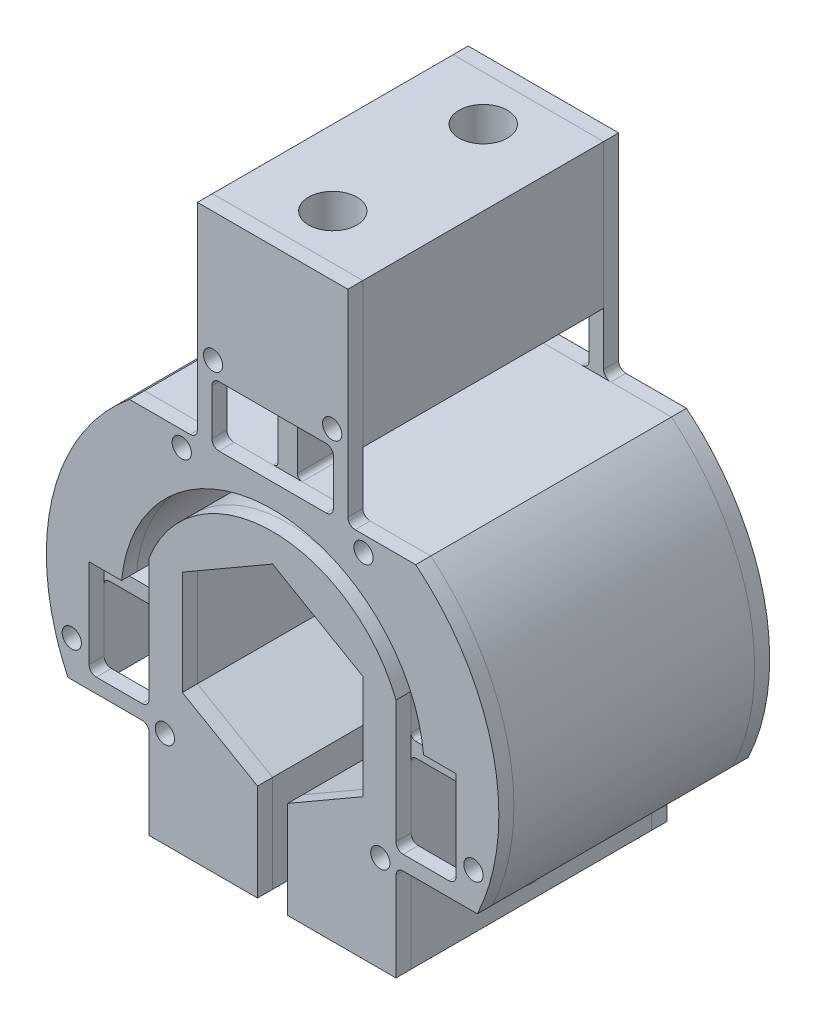
from build123d import *

# Parameters (mm, degrees)
MONKEY_CENTER_W                      = 15.875
MONKEY_CENTER_H                      = 15.24
MONKEY_CENTER_W_2                    = 2.032
MONKEY_CENTER_H_2                    = 6.35
MONKEY_CENTER_W_3                    = 6.35
MONKEY_CENTER_H_3                    = 1.524
CENTRAL_MONKEY_DEPTH                 = 12.7
CENTRAL_MONKEY_FILLETS_R             = 0.508
MONKEY_FRONT_W                       = 15.875
MONKEY_FRONT_H                       = 15.24
MONKEY_FRONT_W_2                     = 1.524
MONKEY_FRONT_H_2                     = 6.35
MONKEY_FRONT_W_3                     = 6.35
MONKEY_FRONT_H_3                     = 1.524
FRONT_MONKEY_DEPTH                   = 1.5875
FRONT_MONKEY_FILLETS_R               = 0.762
TAP_DRILL_FOR_2_56_TAP1_AT_2_COUNT   = 2
TAP_DRILL_FOR_2_56_TAP1_AT_2_PITCH   = 12.573
TAP_DRILL_FOR_2_56_TAP1_AT_3_COUNT   = 2
TAP_DRILL_FOR_2_56_TAP1_AT_3_PITCH   = 18.578932397
TAP_DRILL_FOR_2_56_TAP1_AT_4_COUNT   = 2
TAP_DRILL_FOR_2_56_TAP1_AT_4_PITCH   = 10.201191499
TAP_DRILL_FOR_2_56_TAP1_AT_5_COUNT   = 2
TAP_DRILL_FOR_2_56_TAP1_AT_5_PITCH   = 36.068614046
TAP_DRILL_FOR_2_56_TAP1_AT_6_COUNT   = 2
TAP_DRILL_FOR_2_56_TAP1_AT_6_PITCH   = 37.005085657
TAP_DRILL_FOR_2_56_TAP1_AT_7_COUNT   = 2
TAP_DRILL_FOR_2_56_TAP1_AT_7_PITCH   = 40.684129258
TAP_DRILL_FOR_2_56_TAP1_AT_8_COUNT   = 2
TAP_DRILL_FOR_2_56_TAP1_AT_8_PITCH   = 42.8232872
BOLT_CLEARANCE_R                     = 1.016
CLEARANCE_DEPTH                      = 26.9875
BOLTS_MIRROR_START                   = -14.2875
BOLTS_MIRROR_OUTLINE_R               = 1.016
BOLTS_MIRROR_DEPTH                   = 1.5875
SKETCH16_W                           = 1.35255
SKETCH16_H                           = 11.431
TAP_DRILL_FOR_1_4_20_TAP1_AT_2_COUNT = 2
TAP_DRILL_FOR_1_4_20_TAP1_AT_2_PITCH = 15.875


# Read off the part's stored shape, not the designer's step: bolts-mirror
with BuildPart() as part:
    # monkey-center → central-monkey (new, symmetric)
    with BuildSketch(Plane.XY):
        with Locations((0, 32.46374)):
            Rectangle(MONKEY_CENTER_W, MONKEY_CENTER_H)
        with Locations((0, 21.66874)):
            Rectangle(MONKEY_CENTER_W_2, MONKEY_CENTER_H_2)
        with BuildLine():
            Line((21.606429043, -10.16), (19.3675, -10.16))
            Line((19.3675, -10.16), (19.3675, 1.524))
            Line((19.3675, 1.524), (15.932887217, 1.524))
            ThreePointArc((15.932887217, 1.524), (0, 16.005607489), (-15.932887217, 1.524))
            Line((-15.932887217, 1.524), (-19.3675, 1.524))
            Line((-19.3675, 1.524), (-19.3675, -10.16))
            Line((-19.3675, -10.16), (-21.606429043, -10.16))
            ThreePointArc((-21.606429043, -10.16), (-23.283490521, 5.286061404), (-15.101157466, 18.49374))
            Line((-15.101157466, 18.49374), (15.101157466, 18.49374))
            ThreePointArc((15.101157466, 18.49374), (23.283490521, 5.286061404), (21.606429043, -10.16))
        make_face()
        with BuildLine():
            Line((-1.5875, -10.081979076), (-9.525, -5.499261314))
            Line((-9.525, -5.499261314), (-9.525, 5.499261314))
            Line((-9.525, 5.499261314), (0, 10.998522628))
            Line((0, 10.998522628), (9.525, 5.499261314))
            Line((9.525, 5.499261314), (9.525, -5.499261314))
            Line((9.525, -5.499261314), (1.5875, -10.081979076))
            Line((1.5875, -10.081979076), (1.5875, -20.32))
            Line((1.5875, -20.32), (13.0175, -20.32))
            Line((13.0175, -20.32), (13.0175, -0.762))
            Line((13.0175, -0.762), (13.0175, 0.762))
            Line((13.0175, 0.762), (13.0175, 5.08))
            ThreePointArc((13.0175, 5.08), (0, 13.973607489), (-13.0175, 5.08))
            Line((-13.0175, 5.08), (-13.0175, 0.762))
            Line((-13.0175, 0.762), (-13.0175, -0.762))
            Line((-13.0175, -0.762), (-13.0175, -20.32))
            Line((-13.0175, -20.32), (-1.5875, -20.32))
            Line((-1.5875, -20.32), (-1.5875, -10.081979076))
        make_face()
        with Locations((-16.1925, 0)):
            Rectangle(MONKEY_CENTER_W_3, MONKEY_CENTER_H_3)
        with Locations((16.1925, 0)):
            Rectangle(MONKEY_CENTER_W_3, MONKEY_CENTER_H_3)
    extrude(amount=CENTRAL_MONKEY_DEPTH, both=True)

    # central-monkey-fillets
    central_monkey_fillets_edges = [part.edges().sort_by_distance(p)[0] for p in [
        (13.0175, 0.762, 0),
        (19.3675, 0.762, 0),
        (-19.3675, 0.762, 0),
        (-13.0175, 0.762, 0),
        (-19.3675, -0.762, 0),
        (-1.016, 18.49374, 0),
        (-1.016, 24.84374, 0),
        (1.016, 24.84374, 0),
        (1.016, 18.49374, 0),
        (19.3675, -0.762, 0),
        (13.0175, -0.762, 0),
        (-13.0175, -0.762, 0),
    ]]
    fillet(central_monkey_fillets_edges, radius=CENTRAL_MONKEY_FILLETS_R)


with BuildPart() as body_2:
    # monkey-front → front-monkey (new body)
    with BuildSketch(Plane.XY.offset(12.7)):
        with Locations((0, 32.46374)):
            Rectangle(MONKEY_FRONT_W, MONKEY_FRONT_H)
        with Locations((-7.1755, 21.66874)):
            Rectangle(MONKEY_FRONT_W_2, MONKEY_FRONT_H_2)
        with Locations((7.1755, 21.66874)):
            Rectangle(MONKEY_FRONT_W_2, MONKEY_FRONT_H_2)
        with BuildLine():
            Line((21.606429043, -10.16), (19.3675, -10.16))
            Line((19.3675, -10.16), (19.3675, 1.524))
            Line((19.3675, 1.524), (15.932887217, 1.524))
            ThreePointArc((15.932887217, 1.524), (0, 16.005607489), (-15.932887217, 1.524))
            Line((-15.932887217, 1.524), (-19.3675, 1.524))
            Line((-19.3675, 1.524), (-19.3675, -10.16))
            Line((-19.3675, -10.16), (-21.606429043, -10.16))
            ThreePointArc((-21.606429043, -10.16), (-23.283490521, 5.286061404), (-15.101157466, 18.49374))
            Line((-15.101157466, 18.49374), (15.101157466, 18.49374))
            ThreePointArc((15.101157466, 18.49374), (23.283490521, 5.286061404), (21.606429043, -10.16))
        make_face()
        with BuildLine():
            Line((-1.5875, -10.081979076), (-9.525, -5.499261314))
            Line((-9.525, -5.499261314), (-9.525, 5.499261314))
            Line((-9.525, 5.499261314), (0, 10.998522628))
            Line((0, 10.998522628), (9.525, 5.499261314))
            Line((9.525, 5.499261314), (9.525, -5.499261314))
            Line((9.525, -5.499261314), (1.5875, -10.081979076))
            Line((1.5875, -10.081979076), (1.5875, -20.32))
            Line((1.5875, -20.32), (13.0175, -20.32))
            Line((13.0175, -20.32), (13.0175, -10.16))
            Line((13.0175, -10.16), (13.0175, -8.636))
            Line((13.0175, -8.636), (13.0175, 5.08))
            ThreePointArc((13.0175, 5.08), (0, 13.973607489), (-13.0175, 5.08))
            Line((-13.0175, 5.08), (-13.0175, -8.636))
            Line((-13.0175, -8.636), (-13.0175, -10.16))
            Line((-13.0175, -10.16), (-13.0175, -20.32))
            Line((-13.0175, -20.32), (-1.5875, -20.32))
            Line((-1.5875, -20.32), (-1.5875, -10.081979076))
        make_face()
        with Locations((-16.1925, -9.398)):
            Rectangle(MONKEY_FRONT_W_3, MONKEY_FRONT_H_3)
        with Locations((16.1925, -9.398)):
            Rectangle(MONKEY_FRONT_W_3, MONKEY_FRONT_H_3)
    extrude(amount=FRONT_MONKEY_DEPTH)

    # front-monkey-fillets
    front_monkey_fillets_edges = [body_2.edges().sort_by_distance(p)[0] for p in [
        (6.4135, 18.49374, 13.49375),
        (6.4135, 24.84374, 13.49375),
        (-6.4135, 24.84374, 13.49375),
        (-6.4135, 18.49374, 13.49375),
        (13.0175, -8.636, 13.49375),
        (19.3675, -8.636, 13.49375),
        (-19.3675, -8.636, 13.49375),
        (-13.0175, -8.636, 13.49375),
        (-7.9375, 18.49374, 13.49375),
        (7.9375, 18.49374, 13.49375),
        (13.0175, -10.16, 13.49375),
        (-13.0175, -10.16, 13.49375),
    ]]
    fillet(front_monkey_fillets_edges, radius=FRONT_MONKEY_FILLETS_R)


with BuildPart() as body_3:
    # back-monkey: mirrored copy
    add(body_2.part.mirror(Plane.XY))

    # bolts-mirror outline → bolts-mirror (cut)
    with BuildSketch(Plane.XY.offset(BOLTS_MIRROR_START)):
        with Locations((-21.191800182, -6.35)):
            Circle(BOLTS_MIRROR_OUTLINE_R)
        with Locations((-6.2865, 26.49474)):
            Circle(BOLTS_MIRROR_OUTLINE_R)
        with Locations((21.191800182, -6.35)):
            Circle(BOLTS_MIRROR_OUTLINE_R)
        with Locations((11.3665, -10.16)):
            Circle(BOLTS_MIRROR_OUTLINE_R)
        with Locations((-11.3665, -10.16)):
            Circle(BOLTS_MIRROR_OUTLINE_R)
        with Locations((6.2865, 26.49474)):
            Circle(BOLTS_MIRROR_OUTLINE_R)
        with Locations((-9.5885, 16.84274)):
            Circle(BOLTS_MIRROR_OUTLINE_R)
        with Locations((9.5885, 16.84274)):
            Circle(BOLTS_MIRROR_OUTLINE_R)
    extrude(amount=BOLTS_MIRROR_DEPTH, mode=Mode.SUBTRACT)


with BuildPart() as tap_drill_for_2_56_tap1_tool:
    # Sketch9 → Tap Drill for #2-56 Tap1 (revolve)
    with BuildSketch(Plane(origin=(-6.2865, 26.49474, 14.2875), x_dir=(0, -1, 0), z_dir=(1, 0, 0))):
        Polygon((0, 0), (0, 6.88416509), (0.889, 6.35), (0.889, 0), align=None)
    tap_drill_for_2_56_tap1 = revolve(axis=Axis((-6.2865, 26.49474, 20.6375), (0, 0, -1)))


with BuildPart() as part_1:
    add(part.part)

    # Tap Drill for #2-56 Tap1: cut by tap_drill_for_2_56_tap1_tool
    add(tap_drill_for_2_56_tap1_tool.part, mode=Mode.SUBTRACT)


with BuildPart() as body_2_1:
    add(body_2.part)

    # Tap Drill for #2-56 Tap1: cut by tap_drill_for_2_56_tap1_tool
    add(tap_drill_for_2_56_tap1_tool.part, mode=Mode.SUBTRACT)


with BuildPart() as tap_drill_for_2_56_tap1_at_2_tool:
    # Tap Drill for #2-56 Tap1 at 2: Tap Drill for #2-56 Tap1 ×2
    with Locations(*[(i * TAP_DRILL_FOR_2_56_TAP1_AT_2_PITCH, 0, 0) for i in range(1, TAP_DRILL_FOR_2_56_TAP1_AT_2_COUNT)]):
        add(tap_drill_for_2_56_tap1)


with BuildPart() as part_2:
    add(part_1.part)

    # Tap Drill for #2-56 Tap1 at 2: cut by tap_drill_for_2_56_tap1_at_2_tool
    add(tap_drill_for_2_56_tap1_at_2_tool.part, mode=Mode.SUBTRACT)


with BuildPart() as body_2_2:
    add(body_2_1.part)

    # Tap Drill for #2-56 Tap1 at 2: cut by tap_drill_for_2_56_tap1_at_2_tool
    add(tap_drill_for_2_56_tap1_at_2_tool.part, mode=Mode.SUBTRACT)


with BuildPart() as tap_drill_for_2_56_tap1_at_3_tool:
    # Tap Drill for #2-56 Tap1 at 3: Tap Drill for #2-56 Tap1 ×2
    with Locations(*[Vector(0.8544624449382326, -0.5195131665224453, 0) * (i * TAP_DRILL_FOR_2_56_TAP1_AT_3_PITCH) for i in range(1, TAP_DRILL_FOR_2_56_TAP1_AT_3_COUNT)]):
        add(tap_drill_for_2_56_tap1)


with BuildPart() as part_3:
    add(part_2.part)

    # Tap Drill for #2-56 Tap1 at 3: cut by tap_drill_for_2_56_tap1_at_3_tool
    add(tap_drill_for_2_56_tap1_at_3_tool.part, mode=Mode.SUBTRACT)


with BuildPart() as body_2_3:
    add(body_2_2.part)

    # Tap Drill for #2-56 Tap1 at 3: cut by tap_drill_for_2_56_tap1_at_3_tool
    add(tap_drill_for_2_56_tap1_at_3_tool.part, mode=Mode.SUBTRACT)


with BuildPart() as tap_drill_for_2_56_tap1_at_4_tool:
    # Tap Drill for #2-56 Tap1 at 4: Tap Drill for #2-56 Tap1 ×2
    with Locations(*[Vector(-0.32368767906299, -0.9461639849533562, 0) * (i * TAP_DRILL_FOR_2_56_TAP1_AT_4_PITCH) for i in range(1, TAP_DRILL_FOR_2_56_TAP1_AT_4_COUNT)]):
        add(tap_drill_for_2_56_tap1)


with BuildPart() as part_4:
    add(part_3.part)

    # Tap Drill for #2-56 Tap1 at 4: cut by tap_drill_for_2_56_tap1_at_4_tool
    add(tap_drill_for_2_56_tap1_at_4_tool.part, mode=Mode.SUBTRACT)


with BuildPart() as body_2_4:
    add(body_2_3.part)

    # Tap Drill for #2-56 Tap1 at 4: cut by tap_drill_for_2_56_tap1_at_4_tool
    add(tap_drill_for_2_56_tap1_at_4_tool.part, mode=Mode.SUBTRACT)


with BuildPart() as tap_drill_for_2_56_tap1_at_5_tool:
    # Tap Drill for #2-56 Tap1 at 5: Tap Drill for #2-56 Tap1 ×2
    with Locations(*[Vector(-0.41324848699182054, -0.9106182998375176, 0) * (i * TAP_DRILL_FOR_2_56_TAP1_AT_5_PITCH) for i in range(1, TAP_DRILL_FOR_2_56_TAP1_AT_5_COUNT)]):
        add(tap_drill_for_2_56_tap1)


with BuildPart() as part_5:
    add(part_4.part)

    # Tap Drill for #2-56 Tap1 at 5: cut by tap_drill_for_2_56_tap1_at_5_tool
    add(tap_drill_for_2_56_tap1_at_5_tool.part, mode=Mode.SUBTRACT)


with BuildPart() as body_2_5:
    add(body_2_4.part)

    # Tap Drill for #2-56 Tap1 at 5: cut by tap_drill_for_2_56_tap1_at_5_tool
    add(tap_drill_for_2_56_tap1_at_5_tool.part, mode=Mode.SUBTRACT)


with BuildPart() as tap_drill_for_2_56_tap1_at_6_tool:
    # Tap Drill for #2-56 Tap1 at 6: Tap Drill for #2-56 Tap1 ×2
    with Locations(*[Vector(-0.1372784283520656, -0.9905324997743319, 0) * (i * TAP_DRILL_FOR_2_56_TAP1_AT_6_PITCH) for i in range(1, TAP_DRILL_FOR_2_56_TAP1_AT_6_COUNT)]):
        add(tap_drill_for_2_56_tap1)


with BuildPart() as part_6:
    add(part_5.part)

    # Tap Drill for #2-56 Tap1 at 6: cut by tap_drill_for_2_56_tap1_at_6_tool
    add(tap_drill_for_2_56_tap1_at_6_tool.part, mode=Mode.SUBTRACT)


with BuildPart() as body_2_6:
    add(body_2_5.part)

    # Tap Drill for #2-56 Tap1 at 6: cut by tap_drill_for_2_56_tap1_at_6_tool
    add(tap_drill_for_2_56_tap1_at_6_tool.part, mode=Mode.SUBTRACT)


with BuildPart() as tap_drill_for_2_56_tap1_at_7_tool:
    # Tap Drill for #2-56 Tap1 at 7: Tap Drill for #2-56 Tap1 ×2
    with Locations(*[Vector(0.4339038421623268, -0.9009591865100054, 0) * (i * TAP_DRILL_FOR_2_56_TAP1_AT_7_PITCH) for i in range(1, TAP_DRILL_FOR_2_56_TAP1_AT_7_COUNT)]):
        add(tap_drill_for_2_56_tap1)


with BuildPart() as part_7:
    add(part_6.part)

    # Tap Drill for #2-56 Tap1 at 7: cut by tap_drill_for_2_56_tap1_at_7_tool
    add(tap_drill_for_2_56_tap1_at_7_tool.part, mode=Mode.SUBTRACT)


with BuildPart() as body_2_7:
    add(body_2_6.part)

    # Tap Drill for #2-56 Tap1 at 7: cut by tap_drill_for_2_56_tap1_at_7_tool
    add(tap_drill_for_2_56_tap1_at_7_tool.part, mode=Mode.SUBTRACT)


with BuildPart() as tap_drill_for_2_56_tap1_at_8_tool:
    # Tap Drill for #2-56 Tap1 at 8: Tap Drill for #2-56 Tap1 ×2
    with Locations(*[Vector(0.64166723246373, -0.7669831567787767, 0) * (i * TAP_DRILL_FOR_2_56_TAP1_AT_8_PITCH) for i in range(1, TAP_DRILL_FOR_2_56_TAP1_AT_8_COUNT)]):
        add(tap_drill_for_2_56_tap1)


with BuildPart() as part_8:
    add(part_7.part)

    # Tap Drill for #2-56 Tap1 at 8: cut by tap_drill_for_2_56_tap1_at_8_tool
    add(tap_drill_for_2_56_tap1_at_8_tool.part, mode=Mode.SUBTRACT)

    # bolts-mirror 2 outline → bolts-mirror 2 (revolve, cut)
    with BuildSketch(Plane(origin=(21.191800182, -6.35, 0), x_dir=(1, 0, 0), z_dir=(0, -1, 0))):
        Polygon((0.889, -12.7), (0.889, -7.9375), (0, -7.40333491), (0, -12.7), align=None)
    revolve(axis=Axis((21.191800182, -6.35, 0), (0, 0, 1)), mode=Mode.SUBTRACT)

    # bolts-mirror 3 outline → bolts-mirror 3 (revolve, cut)
    with BuildSketch(Plane(origin=(11.3665, -10.16, 0), x_dir=(1, 0, 0), z_dir=(0, -1, 0))):
        Polygon((0.889, -12.7), (0.889, -7.9375), (0, -7.40333491), (0, -12.7), align=None)
    revolve(axis=Axis((11.3665, -10.16, 0), (0, 0, 1)), mode=Mode.SUBTRACT)

    # bolts-mirror 4 outline → bolts-mirror 4 (revolve, cut)
    with BuildSketch(Plane(origin=(-11.3665, -10.16, 0), x_dir=(1, 0, 0), z_dir=(0, -1, 0))):
        Polygon((0.889, -12.7), (0.889, -7.9375), (0, -7.40333491), (0, -12.7), align=None)
    revolve(axis=Axis((-11.3665, -10.16, 0), (0, 0, 1)), mode=Mode.SUBTRACT)

    # bolts-mirror 5 outline → bolts-mirror 5 (revolve, cut)
    with BuildSketch(Plane(origin=(-21.191800182, -6.35, 0), x_dir=(1, 0, 0), z_dir=(0, -1, 0))):
        Polygon((0.889, -12.7), (0.889, -7.9375), (0, -7.40333491), (0, -12.7), align=None)
    revolve(axis=Axis((-21.191800182, -6.35, 0), (0, 0, 1)), mode=Mode.SUBTRACT)

    # bolts-mirror 6 outline → bolts-mirror 6 (revolve, cut)
    with BuildSketch(Plane(origin=(-9.5885, 16.84274, 0), x_dir=(1, 0, 0), z_dir=(0, -1, 0))):
        Polygon((0.889, -12.7), (0.889, -7.9375), (0, -7.40333491), (0, -12.7), align=None)
    revolve(axis=Axis((-9.5885, 16.84274, 0), (0, 0, 1)), mode=Mode.SUBTRACT)

    # bolts-mirror 7 outline → bolts-mirror 7 (revolve, cut)
    with BuildSketch(Plane(origin=(9.5885, 16.84274, 0), x_dir=(1, 0, 0), z_dir=(0, -1, 0))):
        Polygon((0.889, -12.7), (0.889, -7.9375), (0, -7.40333491), (0, -12.7), align=None)
    revolve(axis=Axis((9.5885, 16.84274, 0), (0, 0, 1)), mode=Mode.SUBTRACT)

    # bolts-mirror 8 outline → bolts-mirror 8 (revolve, cut)
    with BuildSketch(Plane(origin=(6.2865, 26.49474, 0), x_dir=(1, 0, 0), z_dir=(0, -1, 0))):
        Polygon((0.889, -12.7), (0.889, -7.9375), (0, -7.40333491), (0, -12.7), align=None)
    revolve(axis=Axis((6.2865, 26.49474, 0), (0, 0, 1)), mode=Mode.SUBTRACT)

    # bolts-mirror 9 outline → bolts-mirror 9 (revolve, cut)
    with BuildSketch(Plane(origin=(-6.2865, 26.49474, 0), x_dir=(1, 0, 0), z_dir=(0, -1, 0))):
        Polygon((0.889, -12.7), (0.889, -7.9375), (0, -7.40333491), (0, -12.7), align=None)
    revolve(axis=Axis((-6.2865, 26.49474, 0), (0, 0, 1)), mode=Mode.SUBTRACT)

    # Sketch13 → CBORE for #6 Socket Head Cap Screw1 (revolve, cut)
    with BuildSketch(Plane(origin=(13.0175, -15.24, 0), x_dir=(0, 0, -1), z_dir=(0, 1, 0))):
        Polygon((0, 0), (0, 11.43), (1.89865, 11.43), (1.89865, 3.5052), (3.57251, 3.5052), (3.57251, 0), align=None)
    revolve(axis=Axis((19.3675, -15.24, 0), (-1, 0, 0)), mode=Mode.SUBTRACT)

    # Sketch16 → Tap Drill for #6-32 Tap1 (revolve, cut)
    with BuildSketch(Plane(origin=(-13.0175, -15.24, 0), x_dir=(0, 0, 1), z_dir=(0, 1, 0))):
        with Locations((0.676275, 5.7155)):
            Rectangle(SKETCH16_W, SKETCH16_H)
    revolve(axis=Axis((-19.3675, -15.24, 0), (1, 0, 0)), mode=Mode.SUBTRACT)

    # Sketch19 → Tap Drill for 1/4-20 Tap1 (revolve, cut)
    with BuildSketch(Plane(origin=(0, 40.08374, 7.9375), x_dir=(0, 0, 1), z_dir=(1, 0, 0))):
        Polygon((0, 0), (0, 11.693816902), (2.5527, 10.16), (2.5527, 0), align=None)
    tap_drill_for_1_4_20_tap1 = revolve(axis=Axis((0, 46.43374, 7.9375), (0, -1, 0)), mode=Mode.SUBTRACT)

    # Tap Drill for 1/4-20 Tap1 at 2: Tap Drill for 1/4-20 Tap1 ×2
    with Locations(*[(0, 0, -i * TAP_DRILL_FOR_1_4_20_TAP1_AT_2_PITCH) for i in range(1, TAP_DRILL_FOR_1_4_20_TAP1_AT_2_COUNT)]):
        add(tap_drill_for_1_4_20_tap1, mode=Mode.SUBTRACT)


with BuildPart() as body_2_8:
    add(body_2_7.part)

    # Tap Drill for #2-56 Tap1 at 8: cut by tap_drill_for_2_56_tap1_at_8_tool
    add(tap_drill_for_2_56_tap1_at_8_tool.part, mode=Mode.SUBTRACT)

    # bolt-clearance → clearance (cut)
    with BuildSketch(Plane.XY.offset(14.2875)):
        with Locations((-6.2865, 26.49474)):
            Circle(BOLT_CLEARANCE_R)
        with Locations((6.2865, 26.49474)):
            Circle(BOLT_CLEARANCE_R)
        with Locations((-9.5885, 16.84274)):
            Circle(BOLT_CLEARANCE_R)
        with Locations((9.5885, 16.84274)):
            Circle(BOLT_CLEARANCE_R)
        with Locations((-21.191800182, -6.35)):
            Circle(BOLT_CLEARANCE_R)
        with Locations((-11.3665, -10.16)):
            Circle(BOLT_CLEARANCE_R)
        with Locations((11.3665, -10.16)):
            Circle(BOLT_CLEARANCE_R)
        with Locations((21.191800182, -6.35)):
            Circle(BOLT_CLEARANCE_R)
    extrude(amount=-CLEARANCE_DEPTH, mode=Mode.SUBTRACT)


solid = Compound([body_3.part, part_8.part, body_2_8.part])
